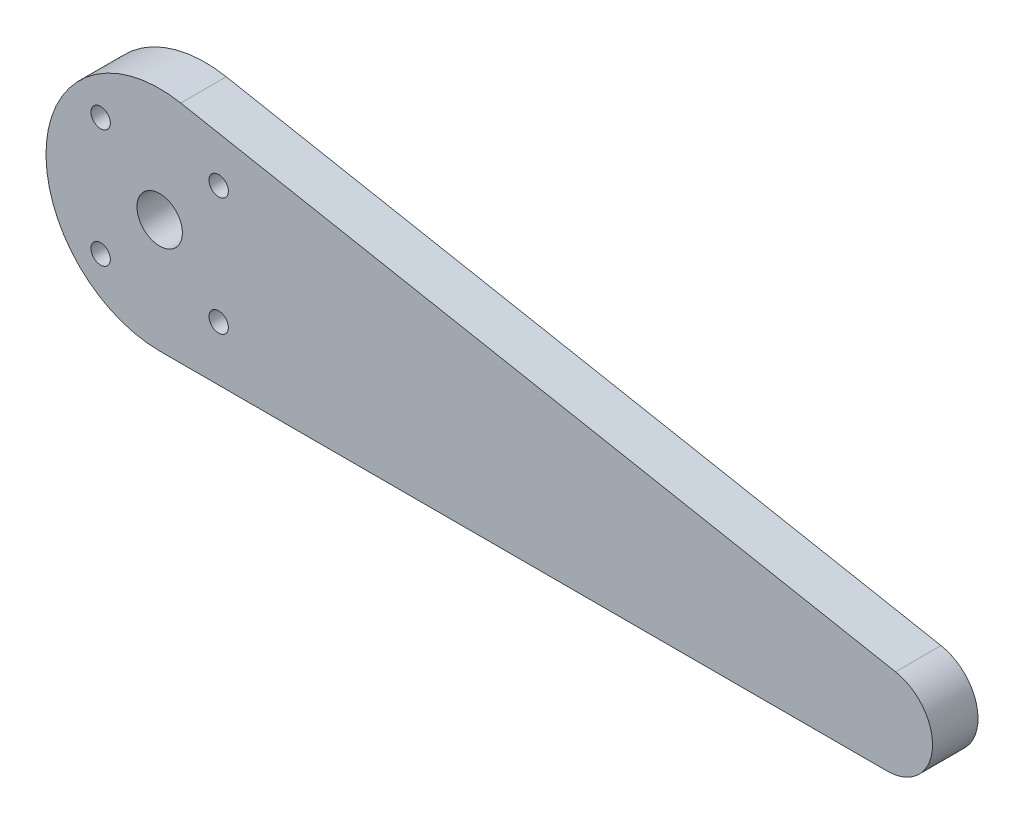
from build123d import *

# Parameters (mm, degrees)
SKETCH1_R             = 3.175
BOSS_EXTRUDE1_DEPTH   = 6.35
F_6_32_TAPPED_HOLE1_D = 2.7051


with BuildPart() as part:
    # Sketch1 → Boss-Extrude1 (new body)
    with BuildSketch(Plane.XY):
        with BuildLine():
            Line((0, -15.875), (101.6, -15.875))
            ThreePointArc((101.6, -15.875), (107.922277335, -10.1177135), (102.780251694, -3.285648596))
            Line((102.780251694, -3.285648596), (2.950629235, 15.598378509))
            ThreePointArc((2.950629235, 15.598378509), (-15.805693339, 1.481783751), (0, -15.875))
        make_face()
        Circle(SKETCH1_R, mode=Mode.SUBTRACT)
    extrude(amount=BOSS_EXTRUDE1_DEPTH)

    # #6-32 Tapped Hole1 (through all)
    with Locations(Plane.XY.offset(6.35)):
        with Locations((8.242390195, 8.242390195), (-8.242390195, 8.242390195), (8.242390195, -8.242390195), (-8.242390195, -8.242390195)):
            Hole(F_6_32_TAPPED_HOLE1_D / 2)


solid = part.part
